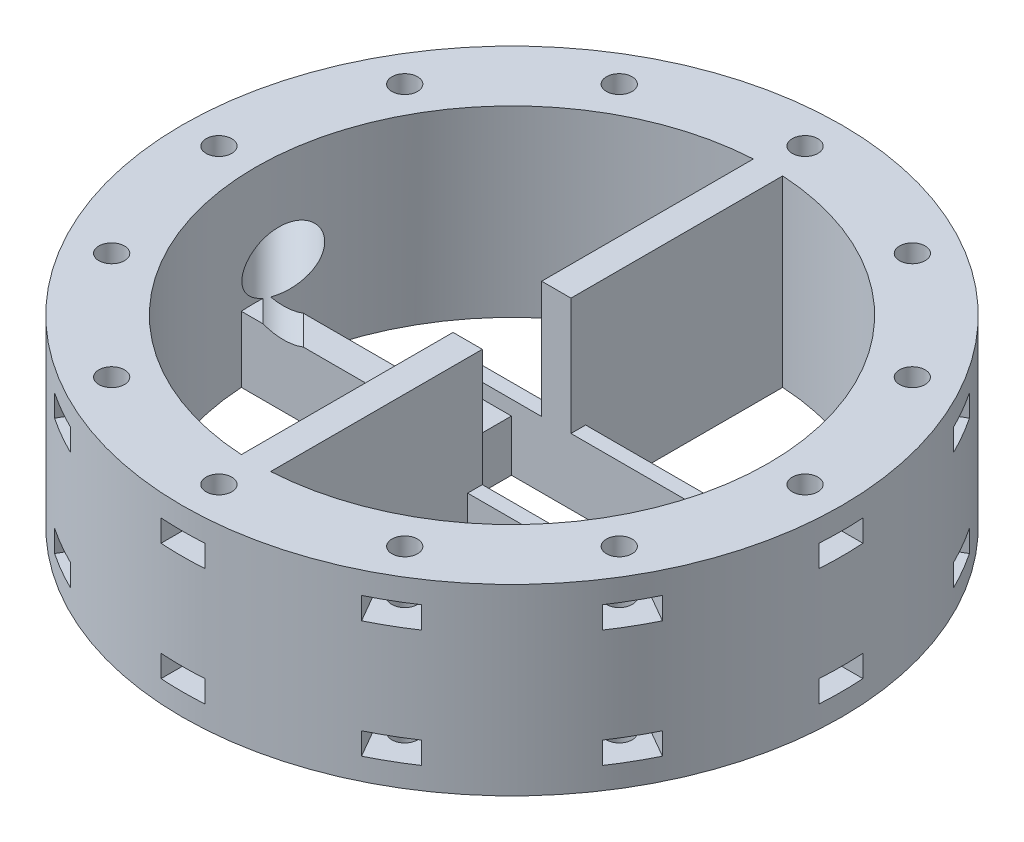
from build123d import *
from build123d.topology import SkipClean

# Parameters (mm, degrees)
SKETCH2_R           = 45
BOSS_EXTRUDE1_DEPTH = 9
SKETCH3_W           = 32.25
SKETCH3_H           = 12.1
CUT_EXTRUDE1_DEPTH  = 2
SKETCH4_W           = 22.6
SKETCH4_H           = 12.1
CUT_EXTRUDE2_DEPTH  = 65.02343321
SKETCH6_R           = 1
CUT_EXTRUDE4_DEPTH  = 65.02343321
CUT_EXTRUDE5_DEPTH  = 65.272855857
BOSS_EXTRUDE2_START = 16
SKETCH13_R          = 45
BOSS_EXTRUDE2_DEPTH = 16
SKETCH10_R          = 1.75
CUT_EXTRUDE7_DEPTH  = 69.373971656
CUT_EXTRUDE8_DEPTH  = 3
SKETCH15_R          = 4
CUT_EXTRUDE9_DEPTH  = 69.373971656


with BuildPart() as part:
    # Sketch2 → Boss-Extrude1 (new body)
    with BuildSketch(Plane(origin=(0, 0, 0), x_dir=(1, 0, 0), z_dir=(0, 1, 0))):
        Circle(SKETCH2_R)
    extrude(amount=BOSS_EXTRUDE1_DEPTH)

    # Sketch3 → Cut-Extrude1 (cut)
    with BuildSketch(Plane(origin=(0, 9, 0), x_dir=(1, 0, 0), z_dir=(0, 1, 0))):
        with Locations((5.175, 0)):
            Rectangle(SKETCH3_W, SKETCH3_H)
    extrude(amount=-CUT_EXTRUDE1_DEPTH, mode=Mode.SUBTRACT)

    # Sketch4 → Cut-Extrude2 (cut, through all)
    with BuildSketch(Plane(origin=(0, 7, 0), x_dir=(1, 0, 0), z_dir=(0, 1, 0))):
        with Locations((5.175, 0)):
            Rectangle(SKETCH4_W, SKETCH4_H)
    extrude(amount=-CUT_EXTRUDE2_DEPTH, mode=Mode.SUBTRACT)

    # Sketch6 → Cut-Extrude4 (cut, through all)
    with BuildSketch(Plane(origin=(0, 7, 0), x_dir=(1, 0, 0), z_dir=(0, 1, 0))):
        with Locations((-8.675, 0)):
            Circle(SKETCH6_R)
        with Locations((19.025, 0)):
            Circle(SKETCH6_R)
    extrude(amount=-CUT_EXTRUDE4_DEPTH, mode=Mode.SUBTRACT)

    # Sketch9 → Cut-Extrude5 (cut, through all)
    with BuildSketch(Plane(origin=(0, 9, 0), x_dir=(1, 0, 0), z_dir=(0, 1, 0))):
        with BuildLine():
            Line((-12.95, 8.05), (-2, 8.05))
            Line((-2, 8.05), (-2, 34.942810419))
            ThreePointArc((-2, 34.942810419), (-24.748737342, 24.748737342), (-34.942810419, 2))
            Line((-34.942810419, 2), (-12.95, 2))
            Line((-12.95, 2), (-12.95, 8.05))
        make_face()
        with BuildLine():
            Line((-12.95, -8.05), (-2, -8.05))
            Line((-2, -8.05), (-2, -34.942810419))
            ThreePointArc((-2, -34.942810419), (-24.748737342, -24.748737342), (-34.942810419, -2))
            Line((-34.942810419, -2), (-12.95, -2))
            Line((-12.95, -2), (-12.95, -8.05))
        make_face()
        with BuildLine():
            Line((2, 34.942810419), (2, 8.05))
            Line((2, 8.05), (34.061672008, 8.05))
            ThreePointArc((34.061672008, 8.05), (22.492595672, 26.815725609), (2, 34.942810419))
        make_face()
        with BuildLine():
            Line((2, -34.942810419), (2, -8.05))
            Line((2, -8.05), (34.061672008, -8.05))
            ThreePointArc((34.061672008, -8.05), (22.492595672, -26.815725609), (2, -34.942810419))
        make_face()
    extrude(amount=-CUT_EXTRUDE5_DEPTH, mode=Mode.SUBTRACT)

    # Sketch13 → Boss-Extrude2 (add)
    with SkipClean():  # the faces are left unmerged after this step: merging them gives an invalid solid
        with BuildSketch(Plane(origin=(0, 9, 0), x_dir=(1, 0, 0), z_dir=(0, 1, 0)).offset(BOSS_EXTRUDE2_START)):
            Circle(SKETCH13_R)
            with BuildLine():
                Line((2, -34.942810419), (2, -8.05))
                Line((2, -8.05), (2, -6.05))
                Line((2, -6.05), (-2, -6.05))
                Line((-2, -6.05), (-2, -8.05))
                Line((-2, -8.05), (-2, -34.942810419))
                ThreePointArc((-2, -34.942810419), (-26.122511764, -23.294084639), (-34.942810419, 2))
                ThreePointArc((-34.942810419, 2), (-24.748737342, 24.748737342), (-2, 34.942810419))
                Line((-2, 34.942810419), (-2, 6.05))
                Line((-2, 6.05), (2, 6.05))
                Line((2, 6.05), (2, 34.942810419))
                ThreePointArc((2, 34.942810419), (25.10008578, 24.392328586), (34.985711369, 1))
                ThreePointArc((34.985711369, 1), (25.786762429, -23.665225193), (2, -34.942810419))
            make_face(mode=Mode.SUBTRACT)
        extrude(amount=-BOSS_EXTRUDE2_DEPTH)

    # Sketch10 → Cut-Extrude7 (cut, through all)
    with SkipClean():  # the faces are left unmerged after this step: merging them gives an invalid solid
        with BuildSketch(Plane.XZ):
            with Locations((-40, 0)):
                Circle(SKETCH10_R)
            with Locations((-34.641016151, 20)):
                Circle(SKETCH10_R)
            with Locations((-20, 34.641016151)):
                Circle(SKETCH10_R)
            with Locations((0, 40)):
                Circle(SKETCH10_R)
            with Locations((20, 34.641016151)):
                Circle(SKETCH10_R)
            with Locations((34.641016151, 20)):
                Circle(SKETCH10_R)
            with Locations((40, 0)):
                Circle(SKETCH10_R)
            with Locations((34.641016151, -20)):
                Circle(SKETCH10_R)
            with Locations((20, -34.641016151)):
                Circle(SKETCH10_R)
            with Locations((0, -40)):
                Circle(SKETCH10_R)
            with Locations((-20, -34.641016151)):
                Circle(SKETCH10_R)
            with Locations((-34.641016151, -20)):
                Circle(SKETCH10_R)
        extrude(amount=-CUT_EXTRUDE7_DEPTH, mode=Mode.SUBTRACT)

    # Sketch14 → Cut-Extrude8 (cut)
    with BuildSketch(Plane(origin=(0, 22, 0), x_dir=(1, 0, 0), z_dir=(0, 1, 0))):
        with BuildLine():
            Line((31.641016151, -18.267949192), (31.641016151, -21.732050808))
            Line((31.641016151, -21.732050808), (37.38444419, -25.048020532))
            ThreePointArc((37.38444419, -25.048020532), (38.97114317, -22.5), (40.38444419, -19.851868109))
            Line((40.38444419, -19.851868109), (34.641016151, -16.535898385))
            Line((34.641016151, -16.535898385), (31.641016151, -18.267949192))
        make_face()
        with BuildLine():
            Line((36.535898385, 0), (38.267949192, -3))
            Line((38.267949192, -3), (44.899888641, -3))
            ThreePointArc((44.899888641, -3), (45, 0), (44.899888641, 3))
            Line((44.899888641, 3), (38.267949192, 3))
            Line((38.267949192, 3), (36.535898385, 0))
        make_face()
        with BuildLine():
            Line((18.267949192, -31.641016151), (16.535898385, -34.641016151))
            Line((16.535898385, -34.641016151), (19.851868109, -40.38444419))
            ThreePointArc((19.851868109, -40.38444419), (22.5, -38.97114317), (25.048020532, -37.38444419))
            Line((25.048020532, -37.38444419), (21.732050808, -31.641016151))
            Line((21.732050808, -31.641016151), (18.267949192, -31.641016151))
        make_face()
        with BuildLine():
            Line((0, -36.535898385), (-3, -38.267949192))
            Line((-3, -38.267949192), (-3, -44.899888641))
            ThreePointArc((-3, -44.899888641), (0, -45), (3, -44.899888641))
            Line((3, -44.899888641), (3, -38.267949192))
            Line((3, -38.267949192), (0, -36.535898385))
        make_face()
        with BuildLine():
            Line((-18.267949192, -31.641016151), (-21.732050808, -31.641016151))
            Line((-21.732050808, -31.641016151), (-25.048020532, -37.38444419))
            ThreePointArc((-25.048020532, -37.38444419), (-22.5, -38.97114317), (-19.851868109, -40.38444419))
            Line((-19.851868109, -40.38444419), (-16.535898385, -34.641016151))
            Line((-16.535898385, -34.641016151), (-18.267949192, -31.641016151))
        make_face()
        with BuildLine():
            Line((-31.641016151, -18.267949192), (-34.641016151, -16.535898385))
            Line((-34.641016151, -16.535898385), (-40.38444419, -19.851868109))
            ThreePointArc((-40.38444419, -19.851868109), (-38.97114317, -22.5), (-37.38444419, -25.048020532))
            Line((-37.38444419, -25.048020532), (-31.641016151, -21.732050808))
            Line((-31.641016151, -21.732050808), (-31.641016151, -18.267949192))
        make_face()
        with BuildLine():
            Line((-36.535898385, 0), (-38.267949192, 3))
            Line((-38.267949192, 3), (-44.899888641, 3))
            ThreePointArc((-44.899888641, 3), (-45, 0), (-44.899888641, -3))
            Line((-44.899888641, -3), (-38.267949192, -3))
            Line((-38.267949192, -3), (-36.535898385, 0))
        make_face()
        with BuildLine():
            Line((-31.641016151, 18.267949192), (-31.641016151, 21.732050808))
            Line((-31.641016151, 21.732050808), (-37.38444419, 25.048020532))
            ThreePointArc((-37.38444419, 25.048020532), (-38.97114317, 22.5), (-40.38444419, 19.851868109))
            Line((-40.38444419, 19.851868109), (-34.641016151, 16.535898385))
            Line((-34.641016151, 16.535898385), (-31.641016151, 18.267949192))
        make_face()
        with BuildLine():
            Line((-18.267949192, 31.641016151), (-16.535898385, 34.641016151))
            Line((-16.535898385, 34.641016151), (-19.851868109, 40.38444419))
            ThreePointArc((-19.851868109, 40.38444419), (-22.5, 38.97114317), (-25.048020532, 37.38444419))
            Line((-25.048020532, 37.38444419), (-21.732050808, 31.641016151))
            Line((-21.732050808, 31.641016151), (-18.267949192, 31.641016151))
        make_face()
        with BuildLine():
            Line((0, 36.535898385), (3, 38.267949192))
            Line((3, 38.267949192), (3, 44.899888641))
            ThreePointArc((3, 44.899888641), (0, 45), (-3, 44.899888641))
            Line((-3, 44.899888641), (-3, 38.267949192))
            Line((-3, 38.267949192), (0, 36.535898385))
        make_face()
        with BuildLine():
            Line((18.267949192, 31.641016151), (21.732050808, 31.641016151))
            Line((21.732050808, 31.641016151), (25.048020532, 37.38444419))
            ThreePointArc((25.048020532, 37.38444419), (22.5, 38.97114317), (19.851868109, 40.38444419))
            Line((19.851868109, 40.38444419), (16.535898385, 34.641016151))
            Line((16.535898385, 34.641016151), (18.267949192, 31.641016151))
        make_face()
        with BuildLine():
            Line((31.641016151, 18.267949192), (34.641016151, 16.535898385))
            Line((34.641016151, 16.535898385), (40.38444419, 19.851868109))
            ThreePointArc((40.38444419, 19.851868109), (38.97114317, 22.5), (37.38444419, 25.048020532))
            Line((37.38444419, 25.048020532), (31.641016151, 21.732050808))
            Line((31.641016151, 21.732050808), (31.641016151, 18.267949192))
        make_face()
    cut_extrude8 = extrude(amount=-CUT_EXTRUDE8_DEPTH, mode=Mode.SUBTRACT)

    # Mirror1: Cut-Extrude8 across plane
    add(cut_extrude8.mirror(Plane.ZX.offset(12.5)), mode=Mode.SUBTRACT)

    # Sketch15 → Cut-Extrude9 (cut, through all)
    with BuildSketch(Plane(origin=(0, 0, 0), x_dir=(-0.7071067811865477, 0, 0.7071067811865474), z_dir=(-0.7071067811865474, 0, -0.7071067811865477))):
        with Locations((22.073209586, 12.5)):
            Circle(SKETCH15_R)
    extrude(amount=CUT_EXTRUDE9_DEPTH, mode=Mode.SUBTRACT)


solid = part.part
